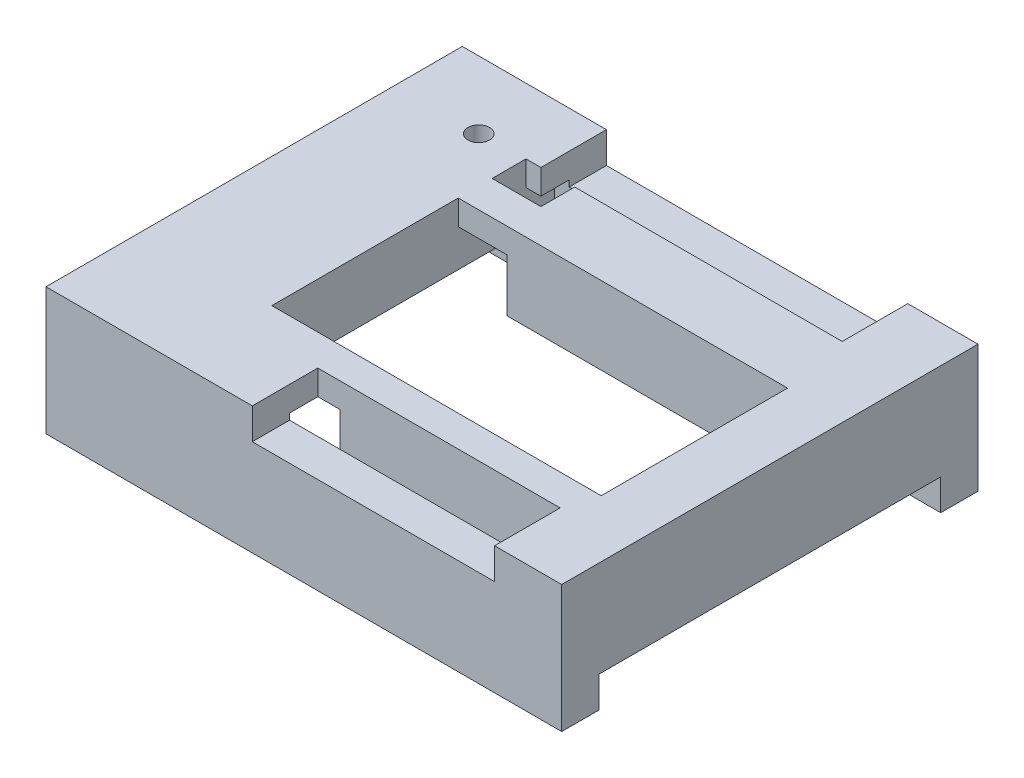
from build123d import *

# Parameters (mm, degrees)
SKETCH1_R               = 1.75
SKETCH1_W               = 53
SKETCH1_H               = 30
BOSS_EXTRUDE1_DEPTH     = 2
BOSS_EXTRUDE2_OUTLINE_R = 1.75
BOSS_EXTRUDE2_DEPTH     = 11.5
SKETCH3_R               = 1.75
SKETCH3_W               = 53
SKETCH3_H               = 30
BOSS_EXTRUDE3_DEPTH     = 2
BOSS_EXTRUDE4_DEPTH     = 6
BOSS_EXTRUDE5_DEPTH     = 6
SKETCH7_W               = 3.3
SKETCH7_H               = 5
CUT_EXTRUDE3_DEPTH      = 2
SKETCH9_W               = 55
SKETCH9_H               = 5.5
CUT_EXTRUDE5_DEPTH      = 14
SKETCH10_W              = 5.5
SKETCH10_H              = 11.5
BOSS_EXTRUDE6_DEPTH     = 55
BOSS_EXTRUDE8_DEPTH     = 8.5
SKETCH14_R              = 1.25
CUT_EXTRUDE6_DEPTH      = 10


# Read off the part's stored shape, not the designer's step: Boss-Extrude2
with BuildPart() as part:
    # Sketch1 → Boss-Extrude1 (new body)
    with BuildSketch(Plane(origin=(0, 0, 0), x_dir=(1, 0, 0), z_dir=(0, 1, 0))):
        Polygon((0, 0), (23.2, 0), (23.2, -4.55), (20.8, -4.55), (20.8, -10), (28.65, -10), (28.65, -4.55), (71.7, -4.55), (71.7, 0), (83, 0), (83, -22.35), (83, -30.15), (83, -55), (72.2, -55), (72.2, -50.45), (33.2, -50.45), (33.2, -55), (0, -55), (0, -50.35), (19, -50.35), (19, -41.35), (0, -41.35), (0, -21.95), (17, -21.95), (17, -9.75), (0, -9.75), align=None)
        with Locations(Location((13.5, -4.85, 0), (0, 0, 270))):
            Circle(SKETCH1_R, mode=Mode.SUBTRACT)
        with Locations((47.3, -30.45)):
            Rectangle(SKETCH1_W, SKETCH1_H, mode=Mode.SUBTRACT)
    extrude(amount=BOSS_EXTRUDE1_DEPTH)

    # Boss-Extrude2 outline → Boss-Extrude2 (add)
    with BuildSketch(Plane.XZ):
        Polygon((0, 9.75), (0, 0), (20.8, 0), (20.8, 55), (0, 55), (0, 50.35), (19, 50.35), (19, 41.35), (0, 41.35), (0, 21.95), (17, 21.95), (17, 9.75), align=None)
        with Locations((13.5, 4.85)):
            Circle(BOSS_EXTRUDE2_OUTLINE_R, mode=Mode.SUBTRACT)
    extrude(amount=BOSS_EXTRUDE2_DEPTH)

    # Sketch3 → Boss-Extrude3 (add)
    with BuildSketch(Plane(origin=(0, 2, 0), x_dir=(1, 0, 0), z_dir=(0, 1, 0))):
        Polygon((23.2, 0), (0, 0), (0, -55), (33.2, -55), (33.2, -50.45), (72.2, -50.45), (72.2, -55), (83, -55), (83, 0), (71.7, 0), (71.7, -4.55), (28.65, -4.55), (28.65, -10), (20.8, -10), (20.8, -4.55), (23.2, -4.55), align=None)
        with Locations(Location((13.5, -4.85, 0), (0, 0, 90))):
            Circle(SKETCH3_R, mode=Mode.SUBTRACT)
        with Locations((47.3, -30.45)):
            Rectangle(SKETCH3_W, SKETCH3_H, mode=Mode.SUBTRACT)
    extrude(amount=BOSS_EXTRUDE3_DEPTH)

    # Sketch4 → Boss-Extrude4 (add)
    with BuildSketch(Plane.XY.offset(55)):
        Polygon((0, 4), (33.2, 4), (33.2, 0), (33.2, -1), (72.2, -1), (72.2, 0), (72.2, 4), (83, 4), (83, -11.5), (83, -16.5), (0, -16.5), (0, -11.5), align=None)
    extrude(amount=BOSS_EXTRUDE4_DEPTH)

    # Sketch5 → Boss-Extrude5 (add)
    with BuildSketch(Plane(origin=(0, 0, 0), x_dir=(-1, 0, 0), z_dir=(0, 0, -1))):
        Polygon((-23.2, 4), (-23.2, 0), (-23.2, -1), (-71.7, -1), (-71.7, 0), (-71.7, 4), (-83, 4), (-83, -11.5), (-83, -16.5), (0, -16.5), (0, -11.5), (0, 4), align=None)
    extrude(amount=BOSS_EXTRUDE5_DEPTH)

    # Sketch7 → Cut-Extrude3 (cut)
    with BuildSketch(Plane(origin=(0, 0, 55), x_dir=(-1, 0, 0), z_dir=(0, 0, -1))):
        with Locations((-14.15, -14)):
            Rectangle(SKETCH7_W, SKETCH7_H)
        with Locations((-68.85, -14)):
            Rectangle(SKETCH7_W, SKETCH7_H)
    extrude(amount=-CUT_EXTRUDE3_DEPTH, mode=Mode.SUBTRACT)

    # Sketch9 → Cut-Extrude5 (cut)
    with BuildSketch(Plane(origin=(20.8, 0, 0), x_dir=(0, 0, -1), z_dir=(1, 0, 0))):
        with Locations((-27.5, -8.75)):
            Rectangle(SKETCH9_W, SKETCH9_H)
    extrude(amount=-CUT_EXTRUDE5_DEPTH, mode=Mode.SUBTRACT)

    # Sketch10 → Boss-Extrude6 (add)
    with BuildSketch(Plane(origin=(0, 0, 55), x_dir=(-1, 0, 0), z_dir=(0, 0, -1))):
        with Locations((-80.25, -5.75)):
            Rectangle(SKETCH10_W, SKETCH10_H)
    extrude(amount=BOSS_EXTRUDE6_DEPTH)

    # Sketch12 → Boss-Extrude8 (add)
    with BuildSketch(Plane.XZ):
        Polygon((73.8, 45.45), (77.5, 45.45), (77.5, 50.45), (72.2, 50.45), (36.8, 50.45), (36.8, 45.45), align=None)
        Polygon((28.65, 10), (28.65, 4.55), (71.7, 4.55), (77.5, 4.55), (77.5, 15.45), (73.8, 15.45), (28.65, 15.45), align=None)
    extrude(amount=BOSS_EXTRUDE8_DEPTH)

    # Sketch14 → Cut-Extrude6 (cut)
    with BuildSketch(Plane.XZ.offset(16.5)):
        with Locations(Location((5, 58, 0), (0, 0, 270))):
            Circle(SKETCH14_R)
        with Locations(Location((78, 58, 0), (0, 0, 90))):
            Circle(SKETCH14_R)
        with Locations(Location((78, -3, 0), (0, 0, 270))):
            Circle(SKETCH14_R)
        with Locations(Location((5, -3, 0), (0, 0, 90))):
            Circle(SKETCH14_R)
    extrude(amount=-CUT_EXTRUDE6_DEPTH, mode=Mode.SUBTRACT)


solid = part.part
